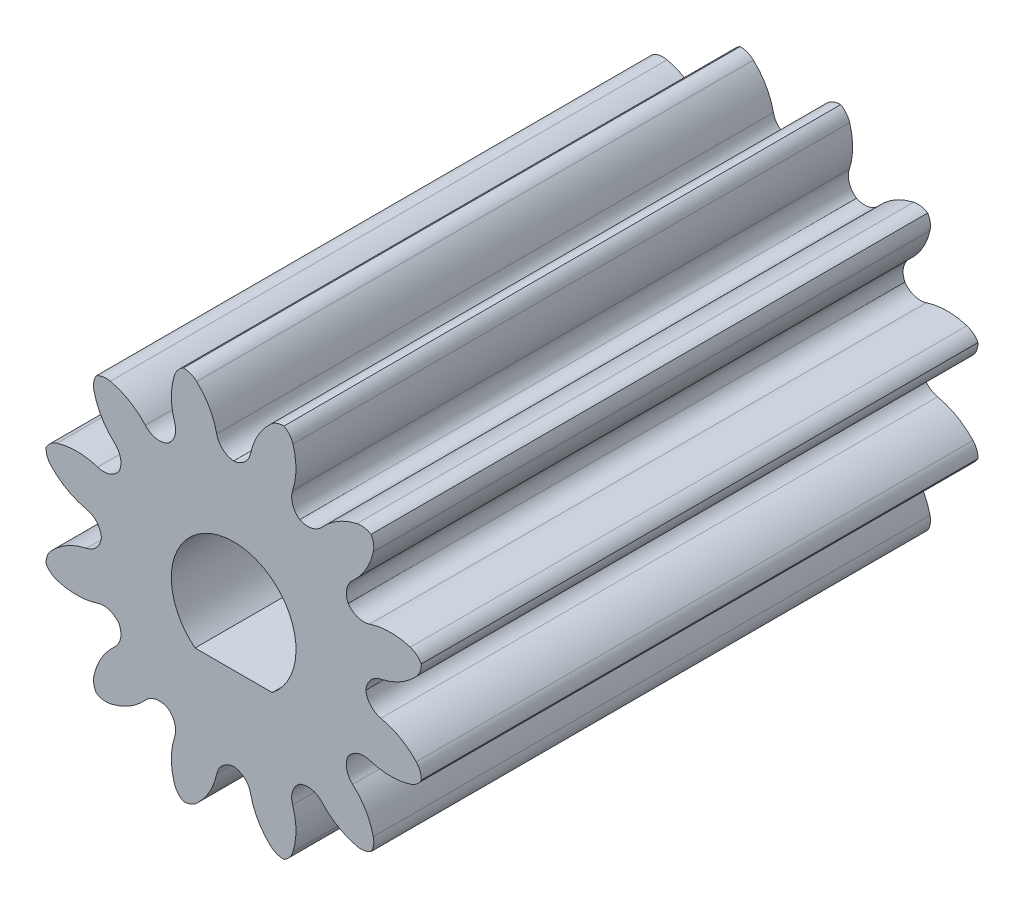
from build123d import *
from OCP.BRepFilletAPI import BRepFilletAPI_MakeChamfer

# Parameters (mm, degrees)
BOSS_EXTRUDE1_DEPTH     = 25
FILLET1_R               = 0.85
CUT_EXTRUDE1_DEPTH      = 28.69523507
CUT_EXTRUDE1_DEPTH_BACK = 28.69523507
CHAMFER1_SIZE           = 2
CHAMFER1_SIZE2          = 0.727940469


with BuildPart() as part:
    # Sketch2 → Boss-Extrude1 (new body)
    with BuildSketch(Plane.XY):
        with BuildLine():
            ThreePointArc((5.45501044, -2.341984918), (6.905444148, -2.794619237), (8.391623483, -2.478538947))
            ThreePointArc((8.391623483, -2.478538947), (8.45185098, -2.264666645), (8.506628589, -2.049334049))
            ThreePointArc((8.506628589, -2.049334049), (7.377599675, -1.03251082), (5.895170077, -0.699286786))
            ThreePointArc((5.895170077, -0.699286786), (5.9365, 0), (5.895170077, 0.699286786))
            ThreePointArc((5.895170077, 0.699286786), (7.377599675, 1.03251082), (8.506628589, 2.049334049))
            ThreePointArc((8.506628589, 2.049334049), (8.45185098, 2.264666645), (8.391623483, 2.478538947))
            ThreePointArc((8.391623483, 2.478538947), (6.905444148, 2.794619237), (5.45501044, 2.341984918))
            ThreePointArc((5.45501044, 2.341984918), (5.14115981, 2.96825), (4.755723654, 3.55318516))
            ThreePointArc((4.755723654, 3.55318516), (5.872933327, 4.582980438), (6.342289434, 6.028089642))
            ThreePointArc((6.342289434, 6.028089642), (6.187184335, 6.187184335), (6.028089642, 6.342289434))
            ThreePointArc((6.028089642, 6.342289434), (4.582980438, 5.872933327), (3.55318516, 4.755723654))
            ThreePointArc((3.55318516, 4.755723654), (2.96825, 5.14115981), (2.341984918, 5.45501044))
            ThreePointArc((2.341984918, 5.45501044), (2.794619237, 6.905444148), (2.478538947, 8.391623483))
            ThreePointArc((2.478538947, 8.391623483), (2.264666645, 8.45185098), (2.049334049, 8.506628589))
            ThreePointArc((2.049334049, 8.506628589), (1.03251082, 7.377599675), (0.699286786, 5.895170077))
            ThreePointArc((0.699286786, 5.895170077), (0, 5.9365), (-0.699286786, 5.895170077))
            ThreePointArc((-0.699286786, 5.895170077), (-1.03251082, 7.377599675), (-2.049334049, 8.506628589))
            ThreePointArc((-2.049334049, 8.506628589), (-2.264666645, 8.45185098), (-2.478538947, 8.391623483))
            ThreePointArc((-2.478538947, 8.391623483), (-2.794619237, 6.905444148), (-2.341984918, 5.45501044))
            ThreePointArc((-2.341984918, 5.45501044), (-2.96825, 5.14115981), (-3.55318516, 4.755723654))
            ThreePointArc((-3.55318516, 4.755723654), (-4.582980438, 5.872933327), (-6.028089642, 6.342289434))
            ThreePointArc((-6.028089642, 6.342289434), (-6.187184335, 6.187184335), (-6.342289434, 6.028089642))
            ThreePointArc((-6.342289434, 6.028089642), (-5.872933327, 4.582980438), (-4.755723654, 3.55318516))
            ThreePointArc((-4.755723654, 3.55318516), (-5.14115981, 2.96825), (-5.45501044, 2.341984918))
            ThreePointArc((-5.45501044, 2.341984918), (-6.905444148, 2.794619237), (-8.391623483, 2.478538947))
            ThreePointArc((-8.391623483, 2.478538947), (-8.45185098, 2.264666645), (-8.506628589, 2.049334049))
            ThreePointArc((-8.506628589, 2.049334049), (-7.377599675, 1.03251082), (-5.895170077, 0.699286786))
            ThreePointArc((-5.895170077, 0.699286786), (-5.9365, 0), (-5.895170077, -0.699286786))
            ThreePointArc((-5.895170077, -0.699286786), (-7.377599675, -1.03251082), (-8.506628589, -2.049334049))
            ThreePointArc((-8.506628589, -2.049334049), (-8.45185098, -2.264666645), (-8.391623483, -2.478538947))
            ThreePointArc((-8.391623483, -2.478538947), (-6.905444148, -2.794619237), (-5.45501044, -2.341984918))
            ThreePointArc((-5.45501044, -2.341984918), (-5.14115981, -2.96825), (-4.755723654, -3.55318516))
            ThreePointArc((-4.755723654, -3.55318516), (-5.872933327, -4.582980438), (-6.342289434, -6.028089642))
            ThreePointArc((-6.342289434, -6.028089642), (-6.187184335, -6.187184335), (-6.028089642, -6.342289434))
            ThreePointArc((-6.028089642, -6.342289434), (-4.582980438, -5.872933327), (-3.55318516, -4.755723654))
            ThreePointArc((-3.55318516, -4.755723654), (-2.96825, -5.14115981), (-2.341984918, -5.45501044))
            ThreePointArc((-2.341984918, -5.45501044), (-2.794619237, -6.905444148), (-2.478538947, -8.391623483))
            ThreePointArc((-2.478538947, -8.391623483), (-2.264666645, -8.45185098), (-2.049334049, -8.506628589))
            ThreePointArc((-2.049334049, -8.506628589), (-1.03251082, -7.377599675), (-0.699286786, -5.895170077))
            ThreePointArc((-0.699286786, -5.895170077), (0, -5.9365), (0.699286786, -5.895170077))
            ThreePointArc((0.699286786, -5.895170077), (1.03251082, -7.377599675), (2.049334049, -8.506628589))
            ThreePointArc((2.049334049, -8.506628589), (2.264666645, -8.45185098), (2.478538947, -8.391623483))
            ThreePointArc((2.478538947, -8.391623483), (2.794619237, -6.905444148), (2.341984918, -5.45501044))
            ThreePointArc((2.341984918, -5.45501044), (2.96825, -5.14115981), (3.55318516, -4.755723654))
            ThreePointArc((3.55318516, -4.755723654), (4.582980438, -5.872933327), (6.028089642, -6.342289434))
            ThreePointArc((6.028089642, -6.342289434), (6.187184335, -6.187184335), (6.342289434, -6.028089642))
            ThreePointArc((6.342289434, -6.028089642), (5.872933327, -4.582980438), (4.755723654, -3.55318516))
            ThreePointArc((4.755723654, -3.55318516), (5.14115981, -2.96825), (5.45501044, -2.341984918))
        make_face()
    extrude(amount=BOSS_EXTRUDE1_DEPTH)

    # Fillet1
    # the kernel refuses this fillet: 0.85 mm, written as the material it adds along each edge
    with BuildSketch(Plane(origin=(-0.699286786, 5.895170077, 0), x_dir=(0.9985545717483048, 0.053747253330377776, 0), z_dir=(0, 0, 1)), Plane(origin=(2.341984918, 5.45501044, 0), x_dir=(0.8916472528643112, -0.4527307991064083, 0), z_dir=(0, 0, 1)), Plane(origin=(4.755723654, 3.55318516, 0), x_dir=(0.5458237726418961, -0.8378999995339347, 0), z_dir=(0, 0, 1)), Plane(origin=(5.895170077, 0.699286786, 0), x_dir=(0.053747253330377526, -0.9985545717483046, 0), z_dir=(0, 0, 1)), Plane(origin=(5.45501044, -2.341984918, 0), x_dir=(-0.4527307991064139, -0.8916472528643083, 0), z_dir=(0, 0, 1)), Plane(origin=(3.55318516, -4.755723654, 0), x_dir=(-0.8378999995339357, -0.5458237726418947, 0), z_dir=(0, 0, 1)), Plane(origin=(0.699286786, -5.895170077, 0), x_dir=(-0.9985545717483045, -0.053747253330380974, 0), z_dir=(0, 0, 1)), Plane(origin=(-2.341984918, -5.45501044, 0), x_dir=(-0.8916472528643078, 0.45273079910641506, 0), z_dir=(0, 0, 1)), Plane(origin=(-4.755723654, -3.55318516, 0), x_dir=(-0.5458237726418926, 0.837899999533937, 0), z_dir=(0, 0, 1)), Plane(origin=(-5.895170077, -0.699286786, 0), x_dir=(-0.05374725333036718, 0.9985545717483052, 0), z_dir=(0, 0, 1)), Plane(origin=(-5.45501044, 2.341984918, 0), x_dir=(0.4527307991064148, 0.8916472528643078, 0), z_dir=(0, 0, 1)), Plane(origin=(-3.55318516, 4.755723654, 0), x_dir=(0.8378999995339407, 0.5458237726418868, 0), z_dir=(0, 0, 1))) as fillet1_piece_1:
        with BuildLine():
            CenterArc((0.817467093, 0.848243697), FILLET1_R, 188.702518153, 77.61362583)
            ThreePointArc((-0.022747059, 0.719635073), (0.010293641, 0.360502417), (0, 0))
            ThreePointArc((0, 0), (0.381426817, 0.012266224), (0.762853635, 0))
        make_face()
    extrude(amount=25)
    with BuildSketch(Plane(origin=(0.699286786, 5.895170077, 0), x_dir=(0.08526813636279139, 0.9963580405262039, 0), z_dir=(0, 0, 1)), Plane(origin=(3.55318516, 4.755723654, 0), x_dir=(0.5720233924866368, 0.8202373061791809, 0), z_dir=(0, 0, 1)), Plane(origin=(5.45501044, 2.341984918, 0), x_dir=(0.9055054425419776, 0.42433464803956017, 0), z_dir=(0, 0, 1)), Plane(origin=(5.895170077, -0.699286786, 0), x_dir=(0.9963580405262035, -0.08526813636279691, 0), z_dir=(0, 0, 1)), Plane(origin=(4.755723654, -3.55318516, 0), x_dir=(0.8202373061791792, -0.5720233924866389, 0), z_dir=(0, 0, 1)), Plane(origin=(2.341984918, -5.45501044, 0), x_dir=(0.4243346480395612, -0.9055054425419772, 0), z_dir=(0, 0, 1)), Plane(origin=(-3.55318516, -4.755723654, 0), x_dir=(-0.5720233924866378, -0.8202373061791799, 0), z_dir=(0, 0, 1)), Plane(origin=(-5.45501044, -2.341984918, 0), x_dir=(-0.9055054425419786, -0.42433464803955767, 0), z_dir=(0, 0, 1)), Plane(origin=(-5.895170077, 0.699286786, 0), x_dir=(-0.9963580405262031, 0.08526813636279934, 0), z_dir=(0, 0, 1)), Plane(origin=(-4.755723654, 3.55318516, 0), x_dir=(-0.8202373061791736, 0.572023392486647, 0), z_dir=(0, 0, 1)), Plane(origin=(-2.341984918, 5.45501044, 0), x_dir=(-0.4243346480395532, 0.9055054425419808, 0), z_dir=(0, 0, 1))) as fillet1_piece_2:
        with BuildLine():
            CenterArc((0.82199371, 0.843857902), FILLET1_R, 185.494324585, 77.61362583)
            ThreePointArc((-0.024101124, 0.762472822), (0.000209539, 0.381623942), (0, 0))
            ThreePointArc((0, 0), (0.359997245, 0.021677992), (0.719994491, 0))
        make_face()
    extrude(amount=25)
    with BuildSketch(Plane(origin=(-0.699286786, -5.895170077, 0), x_dir=(0.9985545717483045, -0.05374725333038154, 0), z_dir=(0, 0, 1))) as fillet1_piece_3:
        with BuildLine():
            CenterArc((0.817467093, -0.848243697), FILLET1_R, 93.683856017, 77.61362583)
            ThreePointArc((-0.022747059, -0.719635073), (0.010293641, -0.360502417), (0, 0))
            ThreePointArc((0, 0), (0.381426817, -0.012266224), (0.762853635, 0))
        make_face()
    extrude(amount=25)
    # the kernel refuses this fillet: 0.85 mm, written as the material it takes off along each edge
    with BuildSketch(Plane(origin=(-2.478538947, 8.391623483, -1.241518227), x_dir=(0.9658977457013398, 0.2589238205516633, 0), z_dir=(0, 0, 1)), Plane(origin=(2.049334049, 8.506628589, -1.241518227), x_dir=(0.9659538955113092, -0.2587142666080226, 0), z_dir=(0, 0, 1)), Plane(origin=(6.028089642, 6.342289434, -1.241518227), x_dir=(0.7071834790933315, -0.7070300749596524, 0), z_dir=(0, 0, 1)), Plane(origin=(8.391623483, 2.478538947, -1.241518227), x_dir=(0.25892382055164814, -0.9658977457013438, 0), z_dir=(0, 0, 1)), Plane(origin=(8.506628589, -2.049334049, -1.241518227), x_dir=(-0.2587142666080043, -0.965953895511314, 0), z_dir=(0, 0, 1)), Plane(origin=(6.342289434, -6.028089642, -1.241518227), x_dir=(-0.7070300749596584, -0.7071834790933254, 0), z_dir=(0, 0, 1)), Plane(origin=(2.478538947, -8.391623483, -1.241518227), x_dir=(-0.9658977457013397, -0.25892382055166346, 0), z_dir=(0, 0, 1)), Plane(origin=(-2.049334049, -8.506628589, -1.241518227), x_dir=(-0.9659538955113074, 0.25871426660802904, 0), z_dir=(0, 0, 1)), Plane(origin=(-6.028089642, -6.342289434, -1.241518227), x_dir=(-0.7071834790933234, 0.7070300749596604, 0), z_dir=(0, 0, 1)), Plane(origin=(-8.506628589, 2.049334049, -1.241518227), x_dir=(0.25871426660802577, 0.9659538955113082, 0), z_dir=(0, 0, 1)), Plane(origin=(-6.342289434, 6.028089642, -1.241518227), x_dir=(0.7070300749596685, 0.7071834790933154, 0), z_dir=(0, 0, 1)), Plane(origin=(-8.391623483, -2.478538947, -1.241518227), x_dir=(-0.2589238205516369, 0.9658977457013469, 0), z_dir=(0, 0, 1))) as fillet1_2_piece_1:
        with BuildLine():
            CenterArc((0.420957609, -0.849728289), FILLET1_R, 88.551251373, 59.262022264)
            ThreePointArc((-0.298411496, -0.396950098), (-0.157433543, -0.192289716), (0, 0))
            ThreePointArc((0, 0), (0.221223969, 0.002797021), (0.442447937, 0))
        make_face()
    extrude(amount=27.483036454, mode=Mode.SUBTRACT)
    with BuildSketch(Plane(origin=(-2.049334049, 8.506628589, -1.241518227), x_dir=(0.7872385442579439, -0.6166485826097658, 0), z_dir=(0, 0, 1)), Plane(origin=(2.478538947, 8.391623483, -1.241518227), x_dir=(0.3734442868607768, -0.9276526098766962, 0), z_dir=(0, 0, 1)), Plane(origin=(6.342289434, 6.028089642, -1.241518227), x_dir=(-0.14041406561875278, -0.9900928694705425, 0), z_dir=(0, 0, 1)), Plane(origin=(8.506628589, 2.049334049, -1.241518227), x_dir=(-0.6166485826097687, -0.7872385442579418, 0), z_dir=(0, 0, 1)), Plane(origin=(8.391623483, -2.478538947, -1.241518227), x_dir=(-0.9276526098766967, -0.3734442868607755, 0), z_dir=(0, 0, 1)), Plane(origin=(6.028089642, -6.342289434, -1.241518227), x_dir=(-0.9900928694705423, 0.14041406561875375, 0), z_dir=(0, 0, 1)), Plane(origin=(2.049334049, -8.506628589, -1.241518227), x_dir=(-0.7872385442579395, 0.6166485826097715, 0), z_dir=(0, 0, 1)), Plane(origin=(-2.478538947, -8.391623483, -1.241518227), x_dir=(-0.37344428686077513, 0.927652609876697, 0), z_dir=(0, 0, 1)), Plane(origin=(-6.342289434, -6.028089642, -1.241518227), x_dir=(0.14041406561875172, 0.9900928694705425, 0), z_dir=(0, 0, 1)), Plane(origin=(-8.506628589, -2.049334049, -1.241518227), x_dir=(0.6166485826097806, 0.7872385442579324, 0), z_dir=(0, 0, 1)), Plane(origin=(-8.391623483, 2.478538947, -1.241518227), x_dir=(0.9276526098767012, 0.3734442868607644, 0), z_dir=(0, 0, 1)), Plane(origin=(-6.028089642, 6.342289434, -1.241518227), x_dir=(0.9900928694705411, -0.140414065618762, 0), z_dir=(0, 0, 1))) as fillet1_2_piece_2:
        with BuildLine():
            CenterArc((0.426254591, -0.847083525), FILLET1_R, 85.252318452, 59.262022264)
            ThreePointArc((-0.265867122, -0.35365923), (-0.135169287, -0.175148884), (0, 0))
            ThreePointArc((0, 0), (0.248303645, 0.010293443), (0.496607291, 0))
        make_face()
    extrude(amount=27.483036454, mode=Mode.SUBTRACT)

    # Sketch3 → Cut-Extrude1 (cut, two sides: drawn at the far end of the back side and taken through both)
    with BuildSketch(Plane(origin=(0, 0, 0), x_dir=(-1, 0, 0), z_dir=(0, 0, -1)).offset(-CUT_EXTRUDE1_DEPTH_BACK)):
        with BuildLine():
            Line((-1.732050808, -2.2), (1.732050808, -2.2))
            ThreePointArc((1.732050808, -2.2), (0, 2.8), (-1.732050808, -2.2))
        make_face()
    extrude(amount=CUT_EXTRUDE1_DEPTH + CUT_EXTRUDE1_DEPTH_BACK, mode=Mode.SUBTRACT)

    # Chamfer1: one chamfer whose edges measure the first distance from different faces: ONE call of the kernel's chamfer builder (chamfer() names one face for all edges)
    chamfer1_edges_1 = [part.edges().sort_by_distance(p)[0] for p in [
        (0, -2.2, 0),
    ]]
    chamfer1_side_1 = [part.faces().sort_by_distance(p)[0] for p in [
        (0, -2.2, 12.5),
    ]]
    chamfer1_edges_2 = [part.edges().sort_by_distance(p)[0] for p in [
        (0, 2.8, 0),
    ]]
    chamfer1_side_2 = [part.faces().sort_by_distance(p)[0] for p in [
        (0, 2.8, 12.5),
    ]]
    chamfer1 = BRepFilletAPI_MakeChamfer(part.part.solid().wrapped)
    for e in chamfer1_edges_1:
        chamfer1.Add(CHAMFER1_SIZE, CHAMFER1_SIZE2, e.wrapped, chamfer1_side_1[0].wrapped)  # the first distance lies on this face
    for e in chamfer1_edges_2:
        chamfer1.Add(CHAMFER1_SIZE, CHAMFER1_SIZE2, e.wrapped, chamfer1_side_2[0].wrapped)  # the first distance lies on this face
    add(Compound.cast(chamfer1.Shape()), mode=Mode.REPLACE)


solid = part.part
